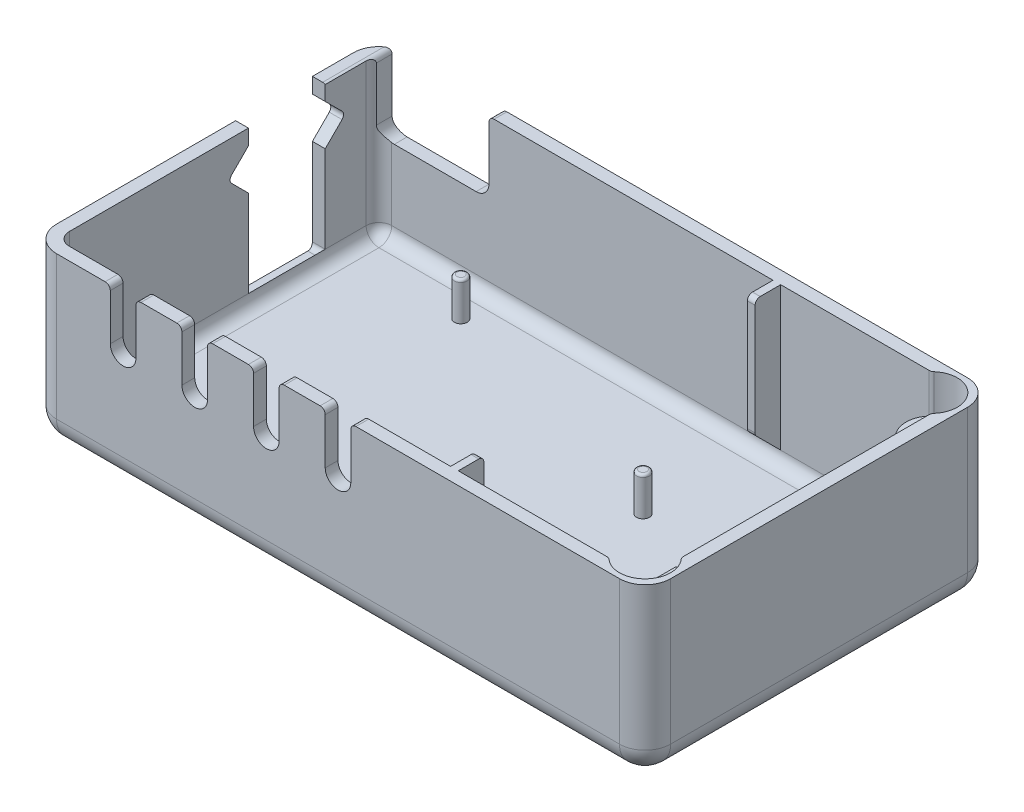
from build123d import *

# Parameters (mm, degrees)
SKETCH1_W           = 120
SKETCH1_H           = 68
BOSS_EXTRUDE1_DEPTH = 33
FILLET1_R           = 5
SHELL1_T            = -2.5
CUT_EXTRUDE2_DEPTH  = 2.5
CUT_EXTRUDE5_REACH  = 98.504
SKETCH5_R           = 5
BOSS_EXTRUDE3_DEPTH = 30.5
FILLET3_R           = 1
CUT_EXTRUDE6_START  = -7.5
SKETCH7_R           = 5
CUT_EXTRUDE6_DEPTH  = 7.5
FILLET4_R           = 1
SKETCH8_R           = 1.25
CUT_EXTRUDE7_DEPTH  = 10
SKETCH9_R           = 1.25
BOSS_EXTRUDE5_DEPTH = 7.5
CUT_EXTRUDE10_REACH = 98.504
FILLET8_R           = 0.5
FILLET9_R           = 1
FILLET10_R          = 1
SKETCH13_W          = 1.5
SKETCH13_H          = 48.928932188
BOSS_EXTRUDE6_DEPTH = 23
SKETCH14_W          = 1.5
SKETCH14_H          = 37
CUT_EXTRUDE12_DEPTH = 20
FILLET11_R          = 1
SKETCH17_W          = 1.5
SKETCH17_H          = 28
BOSS_EXTRUDE7_DEPTH = 5
CHAMFER1_SIZE       = 5
FILLET13_R          = 1
SKETCH18_W          = 1.5
SKETCH18_H          = 28
BOSS_EXTRUDE8_DEPTH = 5
CHAMFER2_SIZE       = 5
FILLET14_R          = 1


# Some blends are built 0.0001 mm under size
with BuildPart() as part:
    # Sketch1 → Boss-Extrude1 (new body)
    with BuildSketch(Plane(origin=(0, 0, 0), x_dir=(1, 0, 0), z_dir=(0, 1, 0))):
        Rectangle(SKETCH1_W, SKETCH1_H)
    extrude(amount=BOSS_EXTRUDE1_DEPTH)

    # Fillet1
    fillet1_edges = [part.edges().sort_by_distance(p)[0] for p in [
        (0, 0, 34),
        (-60, 0, 0),
        (0, 0, -34),
        (60, 0, 0),
        (60, 16.5, 34),
        (-60, 16.5, 34),
        (-60, 16.5, -34),
        (60, 16.5, -34),
    ]]
    fillet(fillet1_edges, radius=FILLET1_R)

    # Shell1
    shell1_openings = [part.faces().sort_by_distance(p)[0] for p in [
        (0, 33, 0),
    ]]
    offset(amount=SHELL1_T, openings=shell1_openings, kind=Kind.INTERSECTION)

    # Sketch2 → Cut-Extrude2 (cut)
    with BuildSketch(Plane.ZY.offset(60)):
        with BuildLine():
            Line((-21, 5), (-21, 22))
            Line((-21, 22), (-25, 26))
            Line((-25, 26), (-21, 30))
            Line((-21, 30), (-21, 33))
            Line((-21, 33), (-6, 33))
            Line((-6, 33), (-6, 30))
            Line((-6, 30), (-2, 26))
            Line((-2, 26), (-6, 22))
            Line((-6, 22), (-6, 5))
            ThreePointArc((-6, 5), (-6.292893219, 4.292893219), (-7, 4))
            Line((-7, 4), (-20, 4))
            ThreePointArc((-20, 4), (-20.707106781, 4.292893219), (-21, 5))
        make_face()
    extrude(amount=-CUT_EXTRUDE2_DEPTH, mode=Mode.SUBTRACT)

    # Sketch4 → Cut-Extrude5 (cut, up to next)
    with BuildSketch(Plane.XY.offset(34), mode=Mode.PRIVATE) as cut_extrude5_sk1:
        with BuildLine():
            Line((-44.5, 33), (-44.5, 23))
            ThreePointArc((-44.5, 23), (-42, 20.5), (-39.5, 23))
            Line((-39.5, 23), (-39.5, 33))
            Line((-39.5, 33), (-44.5, 33))
        make_face()
    cut_extrude5_tool1 = extrude(cut_extrude5_sk1.sketch, amount=-CUT_EXTRUDE5_REACH, mode=Mode.PRIVATE) & part.part
    # Sketch4 → Cut-Extrude5 (cut, up to next)
    with BuildSketch(Plane.XY.offset(34), mode=Mode.PRIVATE) as cut_extrude5_sk2:
        with BuildLine():
            Line((-30.5, 33), (-30.5, 23))
            ThreePointArc((-30.5, 23), (-28, 20.5), (-25.5, 23))
            Line((-25.5, 23), (-25.5, 33))
            Line((-25.5, 33), (-30.5, 33))
        make_face()
    cut_extrude5_tool2 = extrude(cut_extrude5_sk2.sketch, amount=-CUT_EXTRUDE5_REACH, mode=Mode.PRIVATE) & part.part
    # Sketch4 → Cut-Extrude5 (cut, up to next)
    with BuildSketch(Plane.XY.offset(34), mode=Mode.PRIVATE) as cut_extrude5_sk3:
        with BuildLine():
            Line((-16.5, 33), (-16.5, 23))
            ThreePointArc((-16.5, 23), (-14, 20.5), (-11.5, 23))
            Line((-11.5, 23), (-11.5, 33))
            Line((-11.5, 33), (-16.5, 33))
        make_face()
    cut_extrude5_tool3 = extrude(cut_extrude5_sk3.sketch, amount=-CUT_EXTRUDE5_REACH, mode=Mode.PRIVATE) & part.part
    # Sketch4 → Cut-Extrude5 (cut, up to next)
    with BuildSketch(Plane.XY.offset(34), mode=Mode.PRIVATE) as cut_extrude5_sk4:
        with BuildLine():
            Line((-2.5, 33), (-2.5, 23))
            ThreePointArc((-2.5, 23), (0, 20.5), (2.5, 23))
            Line((2.5, 23), (2.5, 33))
            Line((2.5, 33), (-2.5, 33))
        make_face()
    cut_extrude5_tool4 = extrude(cut_extrude5_sk4.sketch, amount=-CUT_EXTRUDE5_REACH, mode=Mode.PRIVATE) & part.part
    add(cut_extrude5_tool1.solids().sort_by_distance((-42, 27.00524, 34))[0], mode=Mode.SUBTRACT)
    add(cut_extrude5_tool2.solids().sort_by_distance((-28, 27.00524, 34))[0], mode=Mode.SUBTRACT)
    add(cut_extrude5_tool3.solids().sort_by_distance((-14, 27.00524, 34))[0], mode=Mode.SUBTRACT)
    add(cut_extrude5_tool4.solids().sort_by_distance((0, 27.00524, 34))[0], mode=Mode.SUBTRACT)

    # Sketch5 → Boss-Extrude3 (add)
    with BuildSketch(Plane(origin=(0, 2.5, 0), x_dir=(1, 0, 0), z_dir=(0, 1, 0))):
        with Locations((54, 28)):
            Circle(SKETCH5_R)
        with Locations((54, -28)):
            Circle(SKETCH5_R)
    extrude(amount=BOSS_EXTRUDE3_DEPTH)

    # Fillet3
    fillet3_edges = [part.edges().sort_by_distance(p)[0] for p in [
        (-39.5, 33, 32.75),
        (-44.5, 33, 32.75),
        (-25.5, 33, 32.75),
        (-30.5, 33, 32.75),
        (-11.5, 33, 32.75),
        (-16.5, 33, 32.75),
        (2.5, 33, 32.75),
        (-2.5, 33, 32.75),
    ]]
    fillet(fillet3_edges, radius=FILLET3_R)

    # Sketch7 → Cut-Extrude6 (cut)
    with BuildSketch(Plane(origin=(0, 33, 0), x_dir=(1, 0, 0), z_dir=(0, 1, 0)).offset(CUT_EXTRUDE6_START)):
        with Locations((54, 28)):
            Circle(SKETCH7_R)
        with Locations((54, -28)):
            Circle(SKETCH7_R)
    extrude(amount=CUT_EXTRUDE6_DEPTH, mode=Mode.SUBTRACT)

    # Fillet4
    # the kernel refuses this fillet: 1 mm, written as the material it takes off along each edge
    with BuildSketch(Plane(origin=(57.5, 33.994781881, -24.429285786), x_dir=(0, 0, 1), z_dir=(0, -1, 0)), Plane(origin=(50.429285786, 33.994781881, 31.5), x_dir=(-1, 0, 0), z_dir=(0, -1, 0))) as fillet4_piece_1:
        with BuildLine():
            CenterArc((0.397912752, -1), FILLET4_R, 90, 41.409622109)
            ThreePointArc((-0.263525075, -0.25), (-0.12949152, -0.127393881), (0, 0))
            Line((0, 0), (0.397912752, 0))
        make_face()
    extrude(amount=8.494781881, mode=Mode.SUBTRACT)
    with BuildSketch(Plane(origin=(50.429285786, 33.994781881, -31.5), x_dir=(0.7254787761567195, 0, -0.6882445389148746), z_dir=(0, -1, 0))) as fillet4_piece_2:
        with BuildLine():
            CenterArc((0.399567282, -0.999340055), FILLET4_R, 92.081686945, 41.409622109)
            Line((-0.288677257, -0.273861279), (0, 0))
            ThreePointArc((0, 0), (0.181621492, -0.003299725), (0.363242984, 0))
        make_face()
    extrude(amount=8.494781881, mode=Mode.SUBTRACT)
    with BuildSketch(Plane(origin=(57.5, 33.994781881, 24.429285786), x_dir=(0, 0, -1), z_dir=(0, -1, 0))) as fillet4_piece_3:
        with BuildLine():
            CenterArc((0.397912752, 1), FILLET4_R, 228.590377891, 41.409622109)
            ThreePointArc((-0.263525075, 0.25), (-0.12949152, 0.127393881), (0, 0))
            Line((0, 0), (0.397912752, 0))
        make_face()
    extrude(amount=8.494781881, mode=Mode.SUBTRACT)

    # Sketch8 → Cut-Extrude7 (cut)
    with BuildSketch(Plane(origin=(0, 25.5, 0), x_dir=(1, 0, 0), z_dir=(0, 1, 0))):
        with Locations(Location((54, 28, 0), (0, 0, 270))):
            Circle(SKETCH8_R)
        with Locations(Location((54, -28, 0), (0, 0, 270))):
            Circle(SKETCH8_R)
    extrude(amount=-CUT_EXTRUDE7_DEPTH, mode=Mode.SUBTRACT)

    # Sketch9 → Boss-Extrude5 (add)
    with BuildSketch(Plane(origin=(0, 2.5, 0), x_dir=(1, 0, 0), z_dir=(0, 1, 0))):
        with Locations(Location((-35, 25, 0), (0, 0, 90))):
            Circle(SKETCH9_R)
        with Locations(Location((15.8, 9.8, 0), (0, 0, 90))):
            Circle(SKETCH9_R)
        with Locations(Location((15.8, -18.1, 0), (0, 0, 90))):
            Circle(SKETCH9_R)
    extrude(amount=BOSS_EXTRUDE5_DEPTH)

    # Sketch12 → Cut-Extrude10 (cut, up to next)
    with BuildSketch(Plane(origin=(0, 0, -34), x_dir=(-1, 0, 0), z_dir=(0, 0, -1)), mode=Mode.PRIVATE) as cut_extrude10_sk1:
        with BuildLine():
            Line((36, 33), (36, 21.5))
            ThreePointArc((36, 21.5), (36.732233047, 19.732233047), (38.5, 19))
            Line((38.5, 19), (54.5, 19))
            ThreePointArc((54.5, 19), (56.267766953, 19.732233047), (57, 21.5))
            Line((57, 21.5), (57, 33))
            Line((57, 33), (36, 33))
        make_face()
    cut_extrude10_tool1 = extrude(cut_extrude10_sk1.sketch, amount=-CUT_EXTRUDE10_REACH, mode=Mode.PRIVATE) & part.part
    add(cut_extrude10_tool1.solids().sort_by_distance((-46.5, 26.059316, -34))[0], mode=Mode.SUBTRACT)

    # Fillet8
    fillet8_edges = [part.edges().sort_by_distance(p)[0] for p in [
        (-35, 10, -23.75),
        (15.8, 10, -8.55),
        (15.8, 10, 19.35),
    ]]
    fillet(fillet8_edges, radius=FILLET8_R)

    # Fillet9
    fillet9_edges = [part.edges().sort_by_distance(p)[0] for p in [
        (-58.75, 26, -25),
        (-58.75, 26, -2),
    ]]
    fillet(fillet9_edges, radius=FILLET9_R)

    # Fillet10
    fillet10_edges = [part.edges().sort_by_distance(p)[0] for p in [
        (-57, 33, -32.041287847),
        (-36, 33, -32.75),
    ]]
    fillet(fillet10_edges, radius=FILLET10_R)

    # Sketch13 → Boss-Extrude6 (add)
    with BuildSketch(Plane(origin=(0, 2.5, 0), x_dir=(1, 0, 0), z_dir=(0, 1, 0))):
        with Locations((51.75, 0)):
            Rectangle(SKETCH13_W, SKETCH13_H)
    extrude(amount=BOSS_EXTRUDE6_DEPTH)

    # Sketch14 → Cut-Extrude12 (cut)
    with BuildSketch(Plane(origin=(0, 25.5, 0), x_dir=(1, 0, 0), z_dir=(0, 1, 0))):
        with Locations((51.75, 0.252304249)):
            Rectangle(SKETCH14_W, SKETCH14_H)
    extrude(amount=-CUT_EXTRUDE12_DEPTH, mode=Mode.SUBTRACT)

    # Fillet11
    fillet11_edges = [part.edges().sort_by_distance(p)[0] for p in [
        (51.75, 25.5, -18.752304249),
        (51.75, 5.5, 18.247695751),
        (51.75, 5.5, -18.752304249),
        (51.75, 25.5, 18.247695751),
    ]]
    fillet(fillet11_edges, radius=FILLET11_R)

    # Sketch17 → Boss-Extrude7 (add)
    with BuildSketch(Plane.XY.offset(-31.5)):
        with Locations((20.25, 19)):
            Rectangle(SKETCH17_W, SKETCH17_H)
    extrude(amount=BOSS_EXTRUDE7_DEPTH)

    # Chamfer1
    chamfer1_edges = [part.edges().sort_by_distance(p)[0] for p in [
        (20.25, 5, -26.5),
    ]]
    chamfer(chamfer1_edges, length=CHAMFER1_SIZE - 0.0001)  # a hair under: the kernel refuses the full size

    # Fillet13
    fillet13_edges = [part.edges().sort_by_distance(p)[0] for p in [
        (20.25, 33, -26.5),
        (20.25, 9.9999, -26.5),
    ]]
    fillet(fillet13_edges, radius=FILLET13_R)

    # Sketch18 → Boss-Extrude8 (add)
    with BuildSketch(Plane(origin=(0, 0, 31.5), x_dir=(-1, 0, 0), z_dir=(0, 0, -1))):
        with Locations((-20.25, 19)):
            Rectangle(SKETCH18_W, SKETCH18_H)
    extrude(amount=BOSS_EXTRUDE8_DEPTH)

    # Chamfer2
    chamfer2_edges = [part.edges().sort_by_distance(p)[0] for p in [
        (20.25, 5, 26.5),
    ]]
    chamfer(chamfer2_edges, length=CHAMFER2_SIZE - 0.0001)  # a hair under: the kernel refuses the full size

    # Fillet14
    fillet14_edges = [part.edges().sort_by_distance(p)[0] for p in [
        (20.25, 33, 26.5),
        (20.25, 9.9999, 26.5),
    ]]
    fillet(fillet14_edges, radius=FILLET14_R)


solid = part.part
